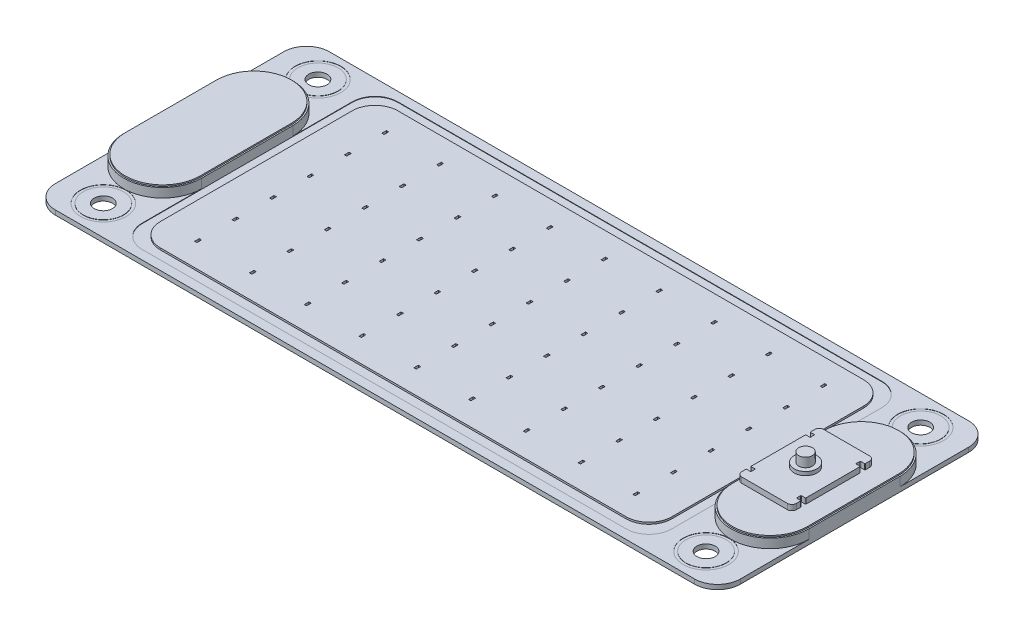
from build123d import *

# Parameters (mm, degrees)
EXTRUDE_1_DEPTH           = 1
EXTRUDE_2_DEPTH           = 2
CUT_EXTRUDE_1_DEPTH       = 0.1
EXTRUDE_3_DEPTH           = 2
EXTRUDE_4_DEPTH           = 0.3
EXTRUDE_5_DEPTH           = 1.2
CUT_EXTRUDE_2_DEPTH       = 1.2
CUT_EXTRUDE_3_DEPTH       = 1.2
EXTRUDE_6_DEPTH           = 0.3
EXTRUDE_7_DEPTH           = 0.4
SKETCH_11_W               = 0.5
SKETCH_11_H               = 1
CUT_EXTRUDE_4_DEPTH       = 0.5
SKETCH_12_W               = 0.5
SKETCH_12_H               = 1
CUT_EXTRUDE_5_DEPTH       = 0.5
SKETCH_13_W               = 0.5
SKETCH_13_H               = 1
CUT_EXTRUDE_6_DEPTH       = 0.5
SKETCH_14_W               = 0.5
SKETCH_14_H               = 1
CUT_EXTRUDE_7_DEPTH       = 0.5
SKETCH_15_W               = 0.5
SKETCH_15_H               = 1
CUT_EXTRUDE_8_DEPTH       = 0.5
SKETCH_16_W               = 0.5
SKETCH_16_H               = 1
CUT_EXTRUDE_9_DEPTH       = 0.5
SKETCH_17_W               = 0.5
SKETCH_17_H               = 1
CUT_EXTRUDE_10_DEPTH      = 0.5
SKETCH_18_W               = 0.5
SKETCH_18_H               = 1
CUT_EXTRUDE_11_DEPTH      = 0.5
SKETCH_19_W               = 0.5
SKETCH_19_H               = 1
CUT_EXTRUDE_12_DEPTH      = 0.5
SKETCH_20_W               = 0.5
SKETCH_20_H               = 1
CUT_EXTRUDE_13_DEPTH      = 0.5
SKETCH_21_W               = 0.5
SKETCH_21_H               = 1
CUT_EXTRUDE_14_DEPTH      = 0.5
SKETCH_22_W               = 0.5
SKETCH_22_H               = 1
CUT_EXTRUDE_15_DEPTH      = 0.5
SKETCH_23_W               = 0.5
SKETCH_23_H               = 1
CUT_EXTRUDE_16_DEPTH      = 0.5
SKETCH_24_W               = 0.5
SKETCH_24_H               = 1
CUT_EXTRUDE_17_DEPTH      = 0.5
SKETCH_25_W               = 0.5
SKETCH_25_H               = 1
CUT_EXTRUDE_18_DEPTH      = 0.5
SKETCH_26_W               = 0.5
SKETCH_26_H               = 1
CUT_EXTRUDE_19_DEPTH      = 0.5
SKETCH_27_W               = 0.5
SKETCH_27_H               = 1
CUT_EXTRUDE_20_DEPTH      = 0.5
SKETCH_28_W               = 0.5
SKETCH_28_H               = 1
CUT_EXTRUDE_21_DEPTH      = 0.5
SKETCH_29_W               = 0.5
SKETCH_29_H               = 1
CUT_EXTRUDE_22_DEPTH      = 0.5
SKETCH_30_W               = 0.5
SKETCH_30_H               = 1
CUT_EXTRUDE_23_DEPTH      = 0.5
SKETCH_31_W               = 0.5
SKETCH_31_H               = 1
CUT_EXTRUDE_24_DEPTH      = 0.5
SKETCH_32_W               = 0.5
SKETCH_32_H               = 1
CUT_EXTRUDE_25_DEPTH      = 0.5
SKETCH_33_W               = 0.5
SKETCH_33_H               = 1
CUT_EXTRUDE_26_DEPTH      = 0.5
SKETCH_34_W               = 0.5
SKETCH_34_H               = 1
CUT_EXTRUDE_27_DEPTH      = 0.5
SKETCH_35_W               = 0.5
SKETCH_35_H               = 1
CUT_EXTRUDE_28_DEPTH      = 0.5
SKETCH_36_W               = 0.5
SKETCH_36_H               = 1
CUT_EXTRUDE_29_DEPTH      = 0.5
SKETCH_37_W               = 0.5
SKETCH_37_H               = 1
CUT_EXTRUDE_30_DEPTH      = 0.5
SKETCH_38_W               = 0.5
SKETCH_38_H               = 1
CUT_EXTRUDE_31_DEPTH      = 0.5
SKETCH_39_W               = 0.5
SKETCH_39_H               = 1
CUT_EXTRUDE_32_DEPTH      = 0.5
SKETCH_40_W               = 0.5
SKETCH_40_H               = 1
CUT_EXTRUDE_33_DEPTH      = 0.5
SKETCH_41_W               = 0.5
SKETCH_41_H               = 1
CUT_EXTRUDE_34_DEPTH      = 0.5
SKETCH_42_W               = 0.5
SKETCH_42_H               = 1
CUT_EXTRUDE_35_DEPTH      = 0.5
SKETCH_43_W               = 0.5
SKETCH_43_H               = 1
CUT_EXTRUDE_36_DEPTH      = 0.5
SKETCH_44_W               = 0.5
SKETCH_44_H               = 1
CUT_EXTRUDE_37_DEPTH      = 0.5
SKETCH_45_W               = 0.5
SKETCH_45_H               = 1
CUT_EXTRUDE_38_DEPTH      = 0.5
SKETCH_46_W               = 0.5
SKETCH_46_H               = 1
CUT_EXTRUDE_39_DEPTH      = 0.5
SKETCH_47_W               = 0.5
SKETCH_47_H               = 1
CUT_EXTRUDE_40_DEPTH      = 0.5
SKETCH_48_W               = 0.5
SKETCH_48_H               = 1
CUT_EXTRUDE_41_DEPTH      = 0.5
SKETCH_49_W               = 0.5
SKETCH_49_H               = 1
CUT_EXTRUDE_42_DEPTH      = 0.5
SKETCH_50_W               = 0.5
SKETCH_50_H               = 1
CUT_EXTRUDE_43_DEPTH      = 0.5
SKETCH_51_W               = 0.5
SKETCH_51_H               = 1
CUT_EXTRUDE_44_DEPTH      = 0.5
SKETCH_52_W               = 0.5
SKETCH_52_H               = 1
CUT_EXTRUDE_45_DEPTH      = 0.5
SKETCH_53_W               = 0.5
SKETCH_53_H               = 1
CUT_EXTRUDE_46_DEPTH      = 0.5
SKETCH_54_W               = 0.5
SKETCH_54_H               = 1
CUT_EXTRUDE_47_DEPTH      = 0.5
SKETCH_55_W               = 0.5
SKETCH_55_H               = 1
CUT_EXTRUDE_48_DEPTH      = 0.5
SKETCH_56_W               = 0.5
SKETCH_56_H               = 1
CUT_EXTRUDE_49_DEPTH      = 0.5
SKETCH_57_W               = 0.5
SKETCH_57_H               = 1
CUT_EXTRUDE_50_DEPTH      = 0.5
SKETCH_58_W               = 0.5
SKETCH_58_H               = 1
CUT_EXTRUDE_51_DEPTH      = 0.5
SKETCH_59_W               = 0.5
SKETCH_59_H               = 1
CUT_EXTRUDE_52_DEPTH      = 0.5
SKETCH_60_W               = 0.5
SKETCH_60_H               = 1
CUT_EXTRUDE_53_DEPTH      = 0.5
SKETCH_61_W               = 0.5
SKETCH_61_H               = 1
CUT_EXTRUDE_54_DEPTH      = 0.5
SKETCH_62_W               = 0.5
SKETCH_62_H               = 1
CUT_EXTRUDE_55_DEPTH      = 0.5
SKETCH_63_W               = 0.5
SKETCH_63_H               = 1
CUT_EXTRUDE_56_DEPTH      = 0.5
SKETCH_64_W               = 0.5
SKETCH_64_H               = 1
CUT_EXTRUDE_57_DEPTH      = 0.5
SKETCH_65_R               = 5.007342078
CUT_EXTRUDE_58_DEPTH      = 0.05
SKETCH_66_R               = 5.007342078
CUT_EXTRUDE_59_DEPTH      = 0.05
SKETCH_67_R               = 5.007342078
CUT_EXTRUDE_60_DEPTH      = 0.05
SKETCH_68_R               = 5.007342078
CUT_EXTRUDE_61_DEPTH      = 0.05
SKETCH_69_W               = 4.4
SKETCH_69_H               = 0.05
SKETCH_70_W               = 4.4
SKETCH_70_H               = 0.05
SKETCH_71_W               = 4.4
SKETCH_71_H               = 0.05
SKETCH_72_W               = 4.4
SKETCH_72_H               = 0.05
HOLE_WIZARD_4_0_4_1_D     = 4
HOLE_WIZARD_4_0_4_1_DEPTH = 7.3
HOLE_WIZARD_2_0_2_1_D     = 2
HOLE_WIZARD_2_0_2_1_DEPTH = 2


with BuildPart() as part:
    # 草图1 → 凸台-拉伸1 (new body)
    with BuildSketch(Plane.XZ):
        with BuildLine():
            Line((-70, -30), (70, -30))
            ThreePointArc((70, -30), (73.535533906, -28.535533906), (75, -25))
            Line((75, -25), (75, 25))
            ThreePointArc((75, 25), (73.535533906, 28.535533906), (70, 30))
            Line((70, 30), (-70, 30))
            ThreePointArc((-70, 30), (-73.535533906, 28.535533906), (-75, 25))
            Line((-75, 25), (-75, -25))
            ThreePointArc((-75, -25), (-73.535533906, -28.535533906), (-70, -30))
        make_face()
    extrude(amount=-EXTRUDE_1_DEPTH)

    # 草图2 → 凸台-拉伸2 (add)
    with BuildSketch(Plane(origin=(0, 1, 0), x_dir=(-1, 0, 0), z_dir=(0, 1, 0))):
        with BuildLine():
            Line((58, -10), (58, 10))
            ThreePointArc((58, 10), (66.5, 18.5), (75, 10))
            Line((75, 10), (75, -10))
            ThreePointArc((75, -10), (66.5, -18.5), (58, -10))
        make_face()
    extrude(amount=EXTRUDE_2_DEPTH)

    # 草图3 → 切除-拉伸1 (cut)
    with BuildSketch(Plane(origin=(0, 1, 0), x_dir=(-1, 0, 0), z_dir=(0, 1, 0))):
        with BuildLine():
            Line((58, -23), (58, 23))
            ThreePointArc((58, 23), (56.535533906, 26.535533906), (53, 28))
            Line((53, 28), (-53, 28))
            ThreePointArc((-53, 28), (-56.535533906, 26.535533906), (-58, 23))
            Line((-58, 23), (-58, -23))
            ThreePointArc((-58, -23), (-56.535533906, -26.535533906), (-53, -28))
            Line((-53, -28), (53, -28))
            ThreePointArc((53, -28), (56.535533906, -26.535533906), (58, -23))
        make_face()
    extrude(amount=-CUT_EXTRUDE_1_DEPTH, mode=Mode.SUBTRACT)

    # 草图4 → 凸台-拉伸3 (add)
    with BuildSketch(Plane(origin=(0, 1, 0), x_dir=(-1, 0, 0), z_dir=(0, 1, 0))):
        with BuildLine():
            Line((-75, -10), (-75, 10))
            ThreePointArc((-75, 10), (-66.5, 18.5), (-58, 10))
            Line((-58, 10), (-58, -10))
            ThreePointArc((-58, -10), (-66.5, -18.5), (-75, -10))
        make_face()
    extrude(amount=EXTRUDE_3_DEPTH)

    # 草图5 → 凸台-拉伸4 (add)
    with BuildSketch(Plane(origin=(0, 3, 0), x_dir=(-1, 0, 0), z_dir=(0, 1, 0))):
        with BuildLine():
            Line((-74.7, -10), (-74.7, 10))
            ThreePointArc((-74.7, 10), (-66.5, 18.2), (-58.3, 10))
            Line((-58.3, 10), (-58.3, -10))
            ThreePointArc((-58.3, -10), (-66.5, -18.2), (-74.7, -10))
        make_face()
    extrude(amount=EXTRUDE_4_DEPTH)

    # 草图6 → 凸台-拉伸5 (add)
    with BuildSketch(Plane(origin=(0, 3.3, 0), x_dir=(-1, 0, 0), z_dir=(0, 1, 0))):
        with BuildLine():
            Line((-59.3, -9), (-69.3, -9))
            ThreePointArc((-69.3, -9), (-70.007106781, -8.707106781), (-70.3, -8))
            Line((-70.3, -8), (-70.3, -7.1))
            ThreePointArc((-70.3, -7.1), (-70.270710678, -7.029289322), (-70.2, -7))
            Line((-70.2, -7), (-69.4, -7))
            ThreePointArc((-69.4, -7), (-69.329289322, -6.970710678), (-69.3, -6.9))
            Line((-69.3, -6.9), (-69.3, -6.1))
            ThreePointArc((-69.3, -6.1), (-69.329289322, -6.029289322), (-69.4, -6))
            Line((-69.4, -6), (-70.2, -6))
            ThreePointArc((-70.2, -6), (-70.270710678, -5.970710678), (-70.3, -5.9))
            Line((-70.3, -5.9), (-70.3, 5.9))
            ThreePointArc((-70.3, 5.9), (-70.270710678, 5.970710678), (-70.2, 6))
            Line((-70.2, 6), (-69.4, 6))
            ThreePointArc((-69.4, 6), (-69.329289322, 6.029289322), (-69.3, 6.1))
            Line((-69.3, 6.1), (-69.3, 6.9))
            ThreePointArc((-69.3, 6.9), (-69.329289322, 6.970710678), (-69.4, 7))
            Line((-69.4, 7), (-70.2, 7))
            ThreePointArc((-70.2, 7), (-70.270710678, 7.029289322), (-70.3, 7.1))
            Line((-70.3, 7.1), (-70.3, 8))
            ThreePointArc((-70.3, 8), (-70.007106781, 8.707106781), (-69.3, 9))
            Line((-69.3, 9), (-59.3, 9))
            ThreePointArc((-59.3, 9), (-58.592893219, 8.707106781), (-58.3, 8))
            Line((-58.3, 8), (-58.3, -8))
            ThreePointArc((-58.3, -8), (-58.592893219, -8.707106781), (-59.3, -9))
        make_face()
    extrude(amount=EXTRUDE_5_DEPTH)

    # 草图7 → 切除-拉伸2 (cut)
    with BuildSketch(Plane(origin=(0, 4.5, 0), x_dir=(-1, 0, 0), z_dir=(0, 1, 0))):
        with BuildLine():
            Line((-58.4, 7), (-59.2, 7))
            ThreePointArc((-59.2, 7), (-59.270710678, 6.970710678), (-59.3, 6.9))
            Line((-59.3, 6.9), (-59.3, 6.1))
            ThreePointArc((-59.3, 6.1), (-59.270710678, 6.029289322), (-59.2, 6))
            Line((-59.2, 6), (-58.4, 6))
            ThreePointArc((-58.4, 6), (-58.329289322, 5.970710678), (-58.3, 5.9))
            Line((-58.3, 5.9), (-58.3, 7.1))
            ThreePointArc((-58.3, 7.1), (-58.329289322, 7.029289322), (-58.4, 7))
        make_face()
    extrude(amount=-CUT_EXTRUDE_2_DEPTH, mode=Mode.SUBTRACT)

    # 草图8 → 切除-拉伸3 (cut)
    with BuildSketch(Plane(origin=(0, 4.5, 0), x_dir=(-1, 0, 0), z_dir=(0, 1, 0))):
        with BuildLine():
            Line((-58.4, -6), (-59.2, -6))
            ThreePointArc((-59.2, -6), (-59.270710678, -6.029289322), (-59.3, -6.1))
            Line((-59.3, -6.1), (-59.3, -6.9))
            ThreePointArc((-59.3, -6.9), (-59.270710678, -6.970710678), (-59.2, -7))
            Line((-59.2, -7), (-58.4, -7))
            ThreePointArc((-58.4, -7), (-58.329289322, -7.029289322), (-58.3, -7.1))
            Line((-58.3, -7.1), (-58.3, -5.9))
            ThreePointArc((-58.3, -5.9), (-58.329289322, -5.970710678), (-58.4, -6))
        make_face()
    extrude(amount=-CUT_EXTRUDE_3_DEPTH, mode=Mode.SUBTRACT)

    # 草图9 → 凸台-拉伸6 (add)
    with BuildSketch(Plane(origin=(0, 3, 0), x_dir=(-1, 0, 0), z_dir=(0, 1, 0))):
        with BuildLine():
            Line((74.7, 10), (74.7, -10))
            ThreePointArc((74.7, -10), (66.5, -18.2), (58.3, -10))
            Line((58.3, -10), (58.3, 10))
            ThreePointArc((58.3, 10), (66.5, 18.2), (74.7, 10))
        make_face()
    extrude(amount=EXTRUDE_6_DEPTH)

    # 草图10 → 凸台-拉伸7 (add)
    with BuildSketch(Plane(origin=(0, 0.9, 0), x_dir=(-1, 0, 0), z_dir=(0, 1, 0))):
        with BuildLine():
            Line((51, -26), (-51, -26))
            ThreePointArc((-51, -26), (-54.535533906, -24.535533906), (-56, -21))
            Line((-56, -21), (-56, 21))
            ThreePointArc((-56, 21), (-54.535533906, 24.535533906), (-51, 26))
            Line((-51, 26), (51, 26))
            ThreePointArc((51, 26), (54.535533906, 24.535533906), (56, 21))
            Line((56, 21), (56, -21))
            ThreePointArc((56, -21), (54.535533906, -24.535533906), (51, -26))
        make_face()
    extrude(amount=EXTRUDE_7_DEPTH)

    # 草图11 → 切除-拉伸4 (cut)
    with BuildSketch(Plane(origin=(0, 1.3, 0), x_dir=(-1, 0, 0), z_dir=(0, 1, 0))):
        with Locations((48.25, -20.5)):
            Rectangle(SKETCH_11_W, SKETCH_11_H)
    extrude(amount=-CUT_EXTRUDE_4_DEPTH, mode=Mode.SUBTRACT)

    # 草图12 → 切除-拉伸5 (cut)
    with BuildSketch(Plane(origin=(0, 1.3, 0), x_dir=(-1, 0, 0), z_dir=(0, 1, 0))):
        with Locations((36.25, -20.5)):
            Rectangle(SKETCH_12_W, SKETCH_12_H)
    extrude(amount=-CUT_EXTRUDE_5_DEPTH, mode=Mode.SUBTRACT)

    # 草图13 → 切除-拉伸6 (cut)
    with BuildSketch(Plane(origin=(0, 1.3, 0), x_dir=(-1, 0, 0), z_dir=(0, 1, 0))):
        with Locations((24.25, -20.5)):
            Rectangle(SKETCH_13_W, SKETCH_13_H)
    extrude(amount=-CUT_EXTRUDE_6_DEPTH, mode=Mode.SUBTRACT)

    # 草图14 → 切除-拉伸7 (cut)
    with BuildSketch(Plane(origin=(0, 1.3, 0), x_dir=(-1, 0, 0), z_dir=(0, 1, 0))):
        with Locations((12.25, -20.5)):
            Rectangle(SKETCH_14_W, SKETCH_14_H)
    extrude(amount=-CUT_EXTRUDE_7_DEPTH, mode=Mode.SUBTRACT)

    # 草图15 → 切除-拉伸8 (cut)
    with BuildSketch(Plane(origin=(0, 1.3, 0), x_dir=(-1, 0, 0), z_dir=(0, 1, 0))):
        with Locations((0.25, -20.5)):
            Rectangle(SKETCH_15_W, SKETCH_15_H)
    extrude(amount=-CUT_EXTRUDE_8_DEPTH, mode=Mode.SUBTRACT)

    # 草图16 → 切除-拉伸9 (cut)
    with BuildSketch(Plane(origin=(0, 1.3, 0), x_dir=(-1, 0, 0), z_dir=(0, 1, 0))):
        with Locations((-11.75, -20.5)):
            Rectangle(SKETCH_16_W, SKETCH_16_H)
    extrude(amount=-CUT_EXTRUDE_9_DEPTH, mode=Mode.SUBTRACT)

    # 草图17 → 切除-拉伸10 (cut)
    with BuildSketch(Plane(origin=(0, 1.3, 0), x_dir=(-1, 0, 0), z_dir=(0, 1, 0))):
        with Locations((-23.75, -20.5)):
            Rectangle(SKETCH_17_W, SKETCH_17_H)
    extrude(amount=-CUT_EXTRUDE_10_DEPTH, mode=Mode.SUBTRACT)

    # 草图18 → 切除-拉伸11 (cut)
    with BuildSketch(Plane(origin=(0, 1.3, 0), x_dir=(-1, 0, 0), z_dir=(0, 1, 0))):
        with Locations((-35.75, -20.5)):
            Rectangle(SKETCH_18_W, SKETCH_18_H)
    extrude(amount=-CUT_EXTRUDE_11_DEPTH, mode=Mode.SUBTRACT)

    # 草图19 → 切除-拉伸12 (cut)
    with BuildSketch(Plane(origin=(0, 1.3, 0), x_dir=(-1, 0, 0), z_dir=(0, 1, 0))):
        with Locations((-47.75, -20.5)):
            Rectangle(SKETCH_19_W, SKETCH_19_H)
    extrude(amount=-CUT_EXTRUDE_12_DEPTH, mode=Mode.SUBTRACT)

    # 草图20 → 切除-拉伸13 (cut)
    with BuildSketch(Plane(origin=(0, 1.3, 0), x_dir=(-1, 0, 0), z_dir=(0, 1, 0))):
        with Locations((48.25, -12.3)):
            Rectangle(SKETCH_20_W, SKETCH_20_H)
    extrude(amount=-CUT_EXTRUDE_13_DEPTH, mode=Mode.SUBTRACT)

    # 草图21 → 切除-拉伸14 (cut)
    with BuildSketch(Plane(origin=(0, 1.3, 0), x_dir=(-1, 0, 0), z_dir=(0, 1, 0))):
        with Locations((36.25, -12.3)):
            Rectangle(SKETCH_21_W, SKETCH_21_H)
    extrude(amount=-CUT_EXTRUDE_14_DEPTH, mode=Mode.SUBTRACT)

    # 草图22 → 切除-拉伸15 (cut)
    with BuildSketch(Plane(origin=(0, 1.3, 0), x_dir=(-1, 0, 0), z_dir=(0, 1, 0))):
        with Locations((24.25, -12.3)):
            Rectangle(SKETCH_22_W, SKETCH_22_H)
    extrude(amount=-CUT_EXTRUDE_15_DEPTH, mode=Mode.SUBTRACT)

    # 草图23 → 切除-拉伸16 (cut)
    with BuildSketch(Plane(origin=(0, 1.3, 0), x_dir=(-1, 0, 0), z_dir=(0, 1, 0))):
        with Locations((12.25, -12.3)):
            Rectangle(SKETCH_23_W, SKETCH_23_H)
    extrude(amount=-CUT_EXTRUDE_16_DEPTH, mode=Mode.SUBTRACT)

    # 草图24 → 切除-拉伸17 (cut)
    with BuildSketch(Plane(origin=(0, 1.3, 0), x_dir=(-1, 0, 0), z_dir=(0, 1, 0))):
        with Locations((0.25, -12.3)):
            Rectangle(SKETCH_24_W, SKETCH_24_H)
    extrude(amount=-CUT_EXTRUDE_17_DEPTH, mode=Mode.SUBTRACT)

    # 草图25 → 切除-拉伸18 (cut)
    with BuildSketch(Plane(origin=(0, 1.3, 0), x_dir=(-1, 0, 0), z_dir=(0, 1, 0))):
        with Locations((-11.75, -12.3)):
            Rectangle(SKETCH_25_W, SKETCH_25_H)
    extrude(amount=-CUT_EXTRUDE_18_DEPTH, mode=Mode.SUBTRACT)

    # 草图26 → 切除-拉伸19 (cut)
    with BuildSketch(Plane(origin=(0, 1.3, 0), x_dir=(-1, 0, 0), z_dir=(0, 1, 0))):
        with Locations((-23.75, -12.3)):
            Rectangle(SKETCH_26_W, SKETCH_26_H)
    extrude(amount=-CUT_EXTRUDE_19_DEPTH, mode=Mode.SUBTRACT)

    # 草图27 → 切除-拉伸20 (cut)
    with BuildSketch(Plane(origin=(0, 1.3, 0), x_dir=(-1, 0, 0), z_dir=(0, 1, 0))):
        with Locations((-35.75, -12.3)):
            Rectangle(SKETCH_27_W, SKETCH_27_H)
    extrude(amount=-CUT_EXTRUDE_20_DEPTH, mode=Mode.SUBTRACT)

    # 草图28 → 切除-拉伸21 (cut)
    with BuildSketch(Plane(origin=(0, 1.3, 0), x_dir=(-1, 0, 0), z_dir=(0, 1, 0))):
        with Locations((-47.75, -12.3)):
            Rectangle(SKETCH_28_W, SKETCH_28_H)
    extrude(amount=-CUT_EXTRUDE_21_DEPTH, mode=Mode.SUBTRACT)

    # 草图29 → 切除-拉伸22 (cut)
    with BuildSketch(Plane(origin=(0, 1.3, 0), x_dir=(-1, 0, 0), z_dir=(0, 1, 0))):
        with Locations((48.25, -4.1)):
            Rectangle(SKETCH_29_W, SKETCH_29_H)
    extrude(amount=-CUT_EXTRUDE_22_DEPTH, mode=Mode.SUBTRACT)

    # 草图30 → 切除-拉伸23 (cut)
    with BuildSketch(Plane(origin=(0, 1.3, 0), x_dir=(-1, 0, 0), z_dir=(0, 1, 0))):
        with Locations((36.25, -4.1)):
            Rectangle(SKETCH_30_W, SKETCH_30_H)
    extrude(amount=-CUT_EXTRUDE_23_DEPTH, mode=Mode.SUBTRACT)

    # 草图31 → 切除-拉伸24 (cut)
    with BuildSketch(Plane(origin=(0, 1.3, 0), x_dir=(-1, 0, 0), z_dir=(0, 1, 0))):
        with Locations((24.25, -4.1)):
            Rectangle(SKETCH_31_W, SKETCH_31_H)
    extrude(amount=-CUT_EXTRUDE_24_DEPTH, mode=Mode.SUBTRACT)

    # 草图32 → 切除-拉伸25 (cut)
    with BuildSketch(Plane(origin=(0, 1.3, 0), x_dir=(-1, 0, 0), z_dir=(0, 1, 0))):
        with Locations((12.25, -4.1)):
            Rectangle(SKETCH_32_W, SKETCH_32_H)
    extrude(amount=-CUT_EXTRUDE_25_DEPTH, mode=Mode.SUBTRACT)

    # 草图33 → 切除-拉伸26 (cut)
    with BuildSketch(Plane(origin=(0, 1.3, 0), x_dir=(-1, 0, 0), z_dir=(0, 1, 0))):
        with Locations((0.25, -4.1)):
            Rectangle(SKETCH_33_W, SKETCH_33_H)
    extrude(amount=-CUT_EXTRUDE_26_DEPTH, mode=Mode.SUBTRACT)

    # 草图34 → 切除-拉伸27 (cut)
    with BuildSketch(Plane(origin=(0, 1.3, 0), x_dir=(-1, 0, 0), z_dir=(0, 1, 0))):
        with Locations((-11.75, -4.1)):
            Rectangle(SKETCH_34_W, SKETCH_34_H)
    extrude(amount=-CUT_EXTRUDE_27_DEPTH, mode=Mode.SUBTRACT)

    # 草图35 → 切除-拉伸28 (cut)
    with BuildSketch(Plane(origin=(0, 1.3, 0), x_dir=(-1, 0, 0), z_dir=(0, 1, 0))):
        with Locations((-23.75, -4.1)):
            Rectangle(SKETCH_35_W, SKETCH_35_H)
    extrude(amount=-CUT_EXTRUDE_28_DEPTH, mode=Mode.SUBTRACT)

    # 草图36 → 切除-拉伸29 (cut)
    with BuildSketch(Plane(origin=(0, 1.3, 0), x_dir=(-1, 0, 0), z_dir=(0, 1, 0))):
        with Locations((-35.75, -4.1)):
            Rectangle(SKETCH_36_W, SKETCH_36_H)
    extrude(amount=-CUT_EXTRUDE_29_DEPTH, mode=Mode.SUBTRACT)

    # 草图37 → 切除-拉伸30 (cut)
    with BuildSketch(Plane(origin=(0, 1.3, 0), x_dir=(-1, 0, 0), z_dir=(0, 1, 0))):
        with Locations((-47.75, -4.1)):
            Rectangle(SKETCH_37_W, SKETCH_37_H)
    extrude(amount=-CUT_EXTRUDE_30_DEPTH, mode=Mode.SUBTRACT)

    # 草图38 → 切除-拉伸31 (cut)
    with BuildSketch(Plane(origin=(0, 1.3, 0), x_dir=(-1, 0, 0), z_dir=(0, 1, 0))):
        with Locations((48.25, 4.1)):
            Rectangle(SKETCH_38_W, SKETCH_38_H)
    extrude(amount=-CUT_EXTRUDE_31_DEPTH, mode=Mode.SUBTRACT)

    # 草图39 → 切除-拉伸32 (cut)
    with BuildSketch(Plane(origin=(0, 1.3, 0), x_dir=(-1, 0, 0), z_dir=(0, 1, 0))):
        with Locations((36.25, 4.1)):
            Rectangle(SKETCH_39_W, SKETCH_39_H)
    extrude(amount=-CUT_EXTRUDE_32_DEPTH, mode=Mode.SUBTRACT)

    # 草图40 → 切除-拉伸33 (cut)
    with BuildSketch(Plane(origin=(0, 1.3, 0), x_dir=(-1, 0, 0), z_dir=(0, 1, 0))):
        with Locations((24.25, 4.1)):
            Rectangle(SKETCH_40_W, SKETCH_40_H)
    extrude(amount=-CUT_EXTRUDE_33_DEPTH, mode=Mode.SUBTRACT)

    # 草图41 → 切除-拉伸34 (cut)
    with BuildSketch(Plane(origin=(0, 1.3, 0), x_dir=(-1, 0, 0), z_dir=(0, 1, 0))):
        with Locations((12.25, 4.1)):
            Rectangle(SKETCH_41_W, SKETCH_41_H)
    extrude(amount=-CUT_EXTRUDE_34_DEPTH, mode=Mode.SUBTRACT)

    # 草图42 → 切除-拉伸35 (cut)
    with BuildSketch(Plane(origin=(0, 1.3, 0), x_dir=(-1, 0, 0), z_dir=(0, 1, 0))):
        with Locations((0.25, 4.1)):
            Rectangle(SKETCH_42_W, SKETCH_42_H)
    extrude(amount=-CUT_EXTRUDE_35_DEPTH, mode=Mode.SUBTRACT)

    # 草图43 → 切除-拉伸36 (cut)
    with BuildSketch(Plane(origin=(0, 1.3, 0), x_dir=(-1, 0, 0), z_dir=(0, 1, 0))):
        with Locations((-11.75, 4.1)):
            Rectangle(SKETCH_43_W, SKETCH_43_H)
    extrude(amount=-CUT_EXTRUDE_36_DEPTH, mode=Mode.SUBTRACT)

    # 草图44 → 切除-拉伸37 (cut)
    with BuildSketch(Plane(origin=(0, 1.3, 0), x_dir=(-1, 0, 0), z_dir=(0, 1, 0))):
        with Locations((-23.75, 4.1)):
            Rectangle(SKETCH_44_W, SKETCH_44_H)
    extrude(amount=-CUT_EXTRUDE_37_DEPTH, mode=Mode.SUBTRACT)

    # 草图45 → 切除-拉伸38 (cut)
    with BuildSketch(Plane(origin=(0, 1.3, 0), x_dir=(-1, 0, 0), z_dir=(0, 1, 0))):
        with Locations((-35.75, 4.1)):
            Rectangle(SKETCH_45_W, SKETCH_45_H)
    extrude(amount=-CUT_EXTRUDE_38_DEPTH, mode=Mode.SUBTRACT)

    # 草图46 → 切除-拉伸39 (cut)
    with BuildSketch(Plane(origin=(0, 1.3, 0), x_dir=(-1, 0, 0), z_dir=(0, 1, 0))):
        with Locations((-47.75, 4.1)):
            Rectangle(SKETCH_46_W, SKETCH_46_H)
    extrude(amount=-CUT_EXTRUDE_39_DEPTH, mode=Mode.SUBTRACT)

    # 草图47 → 切除-拉伸40 (cut)
    with BuildSketch(Plane(origin=(0, 1.3, 0), x_dir=(-1, 0, 0), z_dir=(0, 1, 0))):
        with Locations((48.25, 12.3)):
            Rectangle(SKETCH_47_W, SKETCH_47_H)
    extrude(amount=-CUT_EXTRUDE_40_DEPTH, mode=Mode.SUBTRACT)

    # 草图48 → 切除-拉伸41 (cut)
    with BuildSketch(Plane(origin=(0, 1.3, 0), x_dir=(-1, 0, 0), z_dir=(0, 1, 0))):
        with Locations((36.25, 12.3)):
            Rectangle(SKETCH_48_W, SKETCH_48_H)
    extrude(amount=-CUT_EXTRUDE_41_DEPTH, mode=Mode.SUBTRACT)

    # 草图49 → 切除-拉伸42 (cut)
    with BuildSketch(Plane(origin=(0, 1.3, 0), x_dir=(-1, 0, 0), z_dir=(0, 1, 0))):
        with Locations((24.25, 12.3)):
            Rectangle(SKETCH_49_W, SKETCH_49_H)
    extrude(amount=-CUT_EXTRUDE_42_DEPTH, mode=Mode.SUBTRACT)

    # 草图50 → 切除-拉伸43 (cut)
    with BuildSketch(Plane(origin=(0, 1.3, 0), x_dir=(-1, 0, 0), z_dir=(0, 1, 0))):
        with Locations((12.25, 12.3)):
            Rectangle(SKETCH_50_W, SKETCH_50_H)
    extrude(amount=-CUT_EXTRUDE_43_DEPTH, mode=Mode.SUBTRACT)

    # 草图51 → 切除-拉伸44 (cut)
    with BuildSketch(Plane(origin=(0, 1.3, 0), x_dir=(-1, 0, 0), z_dir=(0, 1, 0))):
        with Locations((0.25, 12.3)):
            Rectangle(SKETCH_51_W, SKETCH_51_H)
    extrude(amount=-CUT_EXTRUDE_44_DEPTH, mode=Mode.SUBTRACT)

    # 草图52 → 切除-拉伸45 (cut)
    with BuildSketch(Plane(origin=(0, 1.3, 0), x_dir=(-1, 0, 0), z_dir=(0, 1, 0))):
        with Locations((-11.75, 12.3)):
            Rectangle(SKETCH_52_W, SKETCH_52_H)
    extrude(amount=-CUT_EXTRUDE_45_DEPTH, mode=Mode.SUBTRACT)

    # 草图53 → 切除-拉伸46 (cut)
    with BuildSketch(Plane(origin=(0, 1.3, 0), x_dir=(-1, 0, 0), z_dir=(0, 1, 0))):
        with Locations((-23.75, 12.3)):
            Rectangle(SKETCH_53_W, SKETCH_53_H)
    extrude(amount=-CUT_EXTRUDE_46_DEPTH, mode=Mode.SUBTRACT)

    # 草图54 → 切除-拉伸47 (cut)
    with BuildSketch(Plane(origin=(0, 1.3, 0), x_dir=(-1, 0, 0), z_dir=(0, 1, 0))):
        with Locations((-35.75, 12.3)):
            Rectangle(SKETCH_54_W, SKETCH_54_H)
    extrude(amount=-CUT_EXTRUDE_47_DEPTH, mode=Mode.SUBTRACT)

    # 草图55 → 切除-拉伸48 (cut)
    with BuildSketch(Plane(origin=(0, 1.3, 0), x_dir=(-1, 0, 0), z_dir=(0, 1, 0))):
        with Locations((-47.75, 12.3)):
            Rectangle(SKETCH_55_W, SKETCH_55_H)
    extrude(amount=-CUT_EXTRUDE_48_DEPTH, mode=Mode.SUBTRACT)

    # 草图56 → 切除-拉伸49 (cut)
    with BuildSketch(Plane(origin=(0, 1.3, 0), x_dir=(-1, 0, 0), z_dir=(0, 1, 0))):
        with Locations((48.25, 20.5)):
            Rectangle(SKETCH_56_W, SKETCH_56_H)
    extrude(amount=-CUT_EXTRUDE_49_DEPTH, mode=Mode.SUBTRACT)

    # 草图57 → 切除-拉伸50 (cut)
    with BuildSketch(Plane(origin=(0, 1.3, 0), x_dir=(-1, 0, 0), z_dir=(0, 1, 0))):
        with Locations((36.25, 20.5)):
            Rectangle(SKETCH_57_W, SKETCH_57_H)
    extrude(amount=-CUT_EXTRUDE_50_DEPTH, mode=Mode.SUBTRACT)

    # 草图58 → 切除-拉伸51 (cut)
    with BuildSketch(Plane(origin=(0, 1.3, 0), x_dir=(-1, 0, 0), z_dir=(0, 1, 0))):
        with Locations((24.25, 20.5)):
            Rectangle(SKETCH_58_W, SKETCH_58_H)
    extrude(amount=-CUT_EXTRUDE_51_DEPTH, mode=Mode.SUBTRACT)

    # 草图59 → 切除-拉伸52 (cut)
    with BuildSketch(Plane(origin=(0, 1.3, 0), x_dir=(-1, 0, 0), z_dir=(0, 1, 0))):
        with Locations((12.25, 20.5)):
            Rectangle(SKETCH_59_W, SKETCH_59_H)
    extrude(amount=-CUT_EXTRUDE_52_DEPTH, mode=Mode.SUBTRACT)

    # 草图60 → 切除-拉伸53 (cut)
    with BuildSketch(Plane(origin=(0, 1.3, 0), x_dir=(-1, 0, 0), z_dir=(0, 1, 0))):
        with Locations((0.25, 20.5)):
            Rectangle(SKETCH_60_W, SKETCH_60_H)
    extrude(amount=-CUT_EXTRUDE_53_DEPTH, mode=Mode.SUBTRACT)

    # 草图61 → 切除-拉伸54 (cut)
    with BuildSketch(Plane(origin=(0, 1.3, 0), x_dir=(-1, 0, 0), z_dir=(0, 1, 0))):
        with Locations((-11.75, 20.5)):
            Rectangle(SKETCH_61_W, SKETCH_61_H)
    extrude(amount=-CUT_EXTRUDE_54_DEPTH, mode=Mode.SUBTRACT)

    # 草图62 → 切除-拉伸55 (cut)
    with BuildSketch(Plane(origin=(0, 1.3, 0), x_dir=(-1, 0, 0), z_dir=(0, 1, 0))):
        with Locations((-23.75, 20.5)):
            Rectangle(SKETCH_62_W, SKETCH_62_H)
    extrude(amount=-CUT_EXTRUDE_55_DEPTH, mode=Mode.SUBTRACT)

    # 草图63 → 切除-拉伸56 (cut)
    with BuildSketch(Plane(origin=(0, 1.3, 0), x_dir=(-1, 0, 0), z_dir=(0, 1, 0))):
        with Locations((-35.75, 20.5)):
            Rectangle(SKETCH_63_W, SKETCH_63_H)
    extrude(amount=-CUT_EXTRUDE_56_DEPTH, mode=Mode.SUBTRACT)

    # 草图64 → 切除-拉伸57 (cut)
    with BuildSketch(Plane(origin=(0, 1.3, 0), x_dir=(-1, 0, 0), z_dir=(0, 1, 0))):
        with Locations((-47.75, 20.5)):
            Rectangle(SKETCH_64_W, SKETCH_64_H)
    extrude(amount=-CUT_EXTRUDE_57_DEPTH, mode=Mode.SUBTRACT)

    # 草图65 → 切除-拉伸58 (cut)
    with BuildSketch(Plane(origin=(0, 1, 0), x_dir=(-1, 0, 0), z_dir=(0, 1, 0))):
        with Locations((66, -23.498084679)):
            Circle(SKETCH_65_R)
    extrude(amount=-CUT_EXTRUDE_58_DEPTH, mode=Mode.SUBTRACT)

    # 草图66 → 切除-拉伸59 (cut)
    with BuildSketch(Plane(origin=(0, 1, 0), x_dir=(-1, 0, 0), z_dir=(0, 1, 0))):
        with Locations((-66, -23.498084679)):
            Circle(SKETCH_66_R)
    extrude(amount=-CUT_EXTRUDE_59_DEPTH, mode=Mode.SUBTRACT)

    # 草图67 → 切除-拉伸60 (cut)
    with BuildSketch(Plane(origin=(0, 1, 0), x_dir=(-1, 0, 0), z_dir=(0, 1, 0))):
        with Locations((-66, 23.498084679)):
            Circle(SKETCH_67_R)
    extrude(amount=-CUT_EXTRUDE_60_DEPTH, mode=Mode.SUBTRACT)

    # 草图68 → 切除-拉伸61 (cut)
    with BuildSketch(Plane(origin=(0, 1, 0), x_dir=(-1, 0, 0), z_dir=(0, 1, 0))):
        with Locations((66, 23.498084679)):
            Circle(SKETCH_68_R)
    extrude(amount=-CUT_EXTRUDE_61_DEPTH, mode=Mode.SUBTRACT)

    # 草图69 → 旋转1 (revolve)
    with BuildSketch(Plane(origin=(0, 0, -23.498084679), x_dir=(-1, 0, 0), z_dir=(0, 0, -1))):
        with Locations((63.8, 0.975)):
            Rectangle(SKETCH_69_W, SKETCH_69_H)
    revolve(axis=Axis((-66, 0.95, -23.498084679), (0, 1, 0)))

    # 草图70 → 旋转2 (revolve)
    with BuildSketch(Plane(origin=(0, 0, -23.498084679), x_dir=(-1, 0, 0), z_dir=(0, 0, -1))):
        with Locations((-68.2, 0.975)):
            Rectangle(SKETCH_70_W, SKETCH_70_H)
    revolve(axis=Axis((66, 0.95, -23.498084679), (0, 1, 0)))

    # 草图71 → 旋转3 (revolve)
    with BuildSketch(Plane(origin=(0, 0, 23.498084679), x_dir=(-1, 0, 0), z_dir=(0, 0, -1))):
        with Locations((-68.2, 0.975)):
            Rectangle(SKETCH_71_W, SKETCH_71_H)
    revolve(axis=Axis((66, 0.95, 23.498084679), (0, 1, 0)))

    # 草图72 → 旋转4 (revolve)
    with BuildSketch(Plane(origin=(0, 0, 23.498084679), x_dir=(-1, 0, 0), z_dir=(0, 0, -1))):
        with Locations((63.8, 0.975)):
            Rectangle(SKETCH_72_W, SKETCH_72_H)
    revolve(axis=Axis((-66, 0.95, 23.498084679), (0, 1, 0)))

    # 草图73 → 旋转5 (revolve)
    with BuildSketch(Plane(origin=(0, 0, 0), x_dir=(-1, 0, 0), z_dir=(0, 0, -1))):
        Polygon((-66.8, 4.5), (-64.3, 4.5), (-64.3, 7.3), (-65.8, 7.3), (-65.8, 5.3), (-66.8, 5.3), align=None)
    revolve(axis=Axis((64.3, 4.5, 0), (0, 1, 0)))

    # Ø4.0 (4) 直径孔1
    with Locations(Plane(origin=(0, 0, 0), x_dir=(-1, 0, 0), z_dir=(0, -1, 0))):
        with Locations((-66, 23.498084679), (-66, -23.498084679), (66, -23.498084679), (66, 23.498084679)):
            Hole(HOLE_WIZARD_4_0_4_1_D / 2, depth=HOLE_WIZARD_4_0_4_1_DEPTH)

    # Ø2.0 (2) 直径孔1
    with Locations(Plane(origin=(0, 0, 0), x_dir=(-1, 0, 0), z_dir=(0, -1, 0))):
        with Locations((70.7, -2), (70.7, 2)):
            Hole(HOLE_WIZARD_2_0_2_1_D / 2, depth=HOLE_WIZARD_2_0_2_1_DEPTH)


solid = part.part
